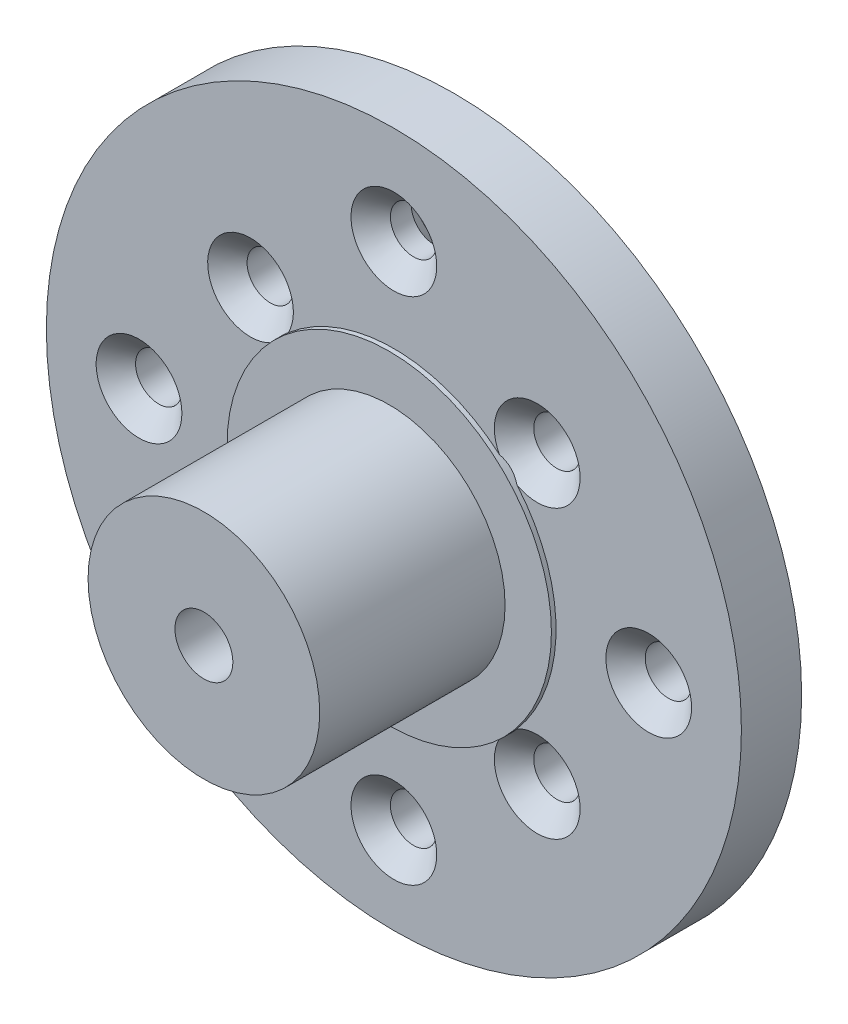
from build123d import *

# Parameters (mm, degrees)
SKETCH_1_R          = 30
SKETCH_1_R_2        = 2
EXTRUDE_1_DEPTH     = 5.2
SKETCH_2_R          = 14
EXTRUDE_2_DEPTH     = 0.4
SKETCH_3_R          = 10
EXTRUDE_3_DEPTH     = 16
SKETCH_4_R          = 2.5
CUT_EXTRUDE_1_DEPTH = 12
CHAMFER_1_SIZE      = 1.7


with BuildPart() as part:
    # 草图1 → 凸台-拉伸1 (new body)
    with BuildSketch(Plane.XY):
        with Locations((0, 0.477974548)):
            Circle(SKETCH_1_R)
        with Locations((0, 22)):
            Circle(SKETCH_1_R_2, mode=Mode.SUBTRACT)
        with Locations((-12.374368671, 12.374368671)):
            Circle(SKETCH_1_R_2, mode=Mode.SUBTRACT)
        with Locations((22, 0)):
            Circle(SKETCH_1_R_2, mode=Mode.SUBTRACT)
        with Locations((12.374368671, 12.374368671)):
            Circle(SKETCH_1_R_2, mode=Mode.SUBTRACT)
        with Locations((0, -22)):
            Circle(SKETCH_1_R_2, mode=Mode.SUBTRACT)
        with Locations((12.374368671, -12.374368671)):
            Circle(SKETCH_1_R_2, mode=Mode.SUBTRACT)
        with Locations((-22, 0)):
            Circle(SKETCH_1_R_2, mode=Mode.SUBTRACT)
        with Locations((-12.374368671, -12.374368671)):
            Circle(SKETCH_1_R_2, mode=Mode.SUBTRACT)
    extrude(amount=EXTRUDE_1_DEPTH)

    # 草图2 → 凸台-拉伸2 (add)
    with BuildSketch(Plane.XY.offset(5.2)):
        Circle(SKETCH_2_R)
    extrude(amount=EXTRUDE_2_DEPTH)

    # 草图3 → 凸台-拉伸3 (add)
    with BuildSketch(Plane.XY.offset(5.6)):
        Circle(SKETCH_3_R)
    extrude(amount=EXTRUDE_3_DEPTH)

    # 草图4 → 切除-拉伸1 (cut)
    with BuildSketch(Plane.XY.offset(21.6)):
        Circle(SKETCH_4_R)
    extrude(amount=-CUT_EXTRUDE_1_DEPTH, mode=Mode.SUBTRACT)

    # 倒角1
    # the kernel refuses this chamfer: 1.7 mm, written as the material it takes off along each edge
    with BuildSketch(Plane(origin=(22, 0, 5.2), x_dir=(1, 0, 0), z_dir=(0, -1, 0))) as chamfer_1_piece_1:
        Polygon((2 + CHAMFER_1_SIZE, 0), (2, -CHAMFER_1_SIZE), (2, 0), align=None)
    revolve(axis=Axis((22, 0, 5.2), (0, 0, 1)), mode=Mode.SUBTRACT)
    with BuildSketch(Plane(origin=(12.374368671, 12.374368671, 5.2), x_dir=(1, 0, 0), z_dir=(0, -1, 0))) as chamfer_1_piece_2_section:
        Polygon((2 + CHAMFER_1_SIZE, 0), (2, -CHAMFER_1_SIZE), (2, 0), align=None)
    chamfer_1_piece_2 = revolve(axis=Axis((12.374368671, 12.374368671, 5.2), (0, 0, 1)), mode=Mode.PRIVATE)
    chamfer_1_piece_2 = chamfer_1_piece_2 - Plane(origin=(0, 0, 4.370822152), x_dir=(1, 0, 0), z_dir=(0, 0, -1)) * Cylinder(14, 15, mode=Mode.PRIVATE)
    add(chamfer_1_piece_2, mode=Mode.SUBTRACT)
    with BuildSketch(Plane(origin=(0, -22, 5.2), x_dir=(1, 0, 0), z_dir=(0, -1, 0))) as chamfer_1_piece_3:
        Polygon((2 + CHAMFER_1_SIZE, 0), (2, -CHAMFER_1_SIZE), (2, 0), align=None)
    revolve(axis=Axis((0, -22, 5.2), (0, 0, 1)), mode=Mode.SUBTRACT)
    with BuildSketch(Plane(origin=(12.374368671, -12.374368671, 5.2), x_dir=(1, 0, 0), z_dir=(0, -1, 0))) as chamfer_1_piece_4_section:
        Polygon((2 + CHAMFER_1_SIZE, 0), (2, -CHAMFER_1_SIZE), (2, 0), align=None)
    chamfer_1_piece_4 = revolve(axis=Axis((12.374368671, -12.374368671, 5.2), (0, 0, 1)), mode=Mode.PRIVATE)
    chamfer_1_piece_4 = chamfer_1_piece_4 - Plane(origin=(0, 0, 4.370822149), x_dir=(1, 0, 0), z_dir=(0, 0, -1)) * Cylinder(14, 15, mode=Mode.PRIVATE)
    add(chamfer_1_piece_4, mode=Mode.SUBTRACT)
    with BuildSketch(Plane(origin=(-22, 0, 5.2), x_dir=(1, 0, 0), z_dir=(0, -1, 0))) as chamfer_1_piece_5:
        Polygon((2 + CHAMFER_1_SIZE, 0), (2, -CHAMFER_1_SIZE), (2, 0), align=None)
    revolve(axis=Axis((-22, 0, 5.2), (0, 0, 1)), mode=Mode.SUBTRACT)
    with BuildSketch(Plane(origin=(-12.374368671, -12.374368671, 5.2), x_dir=(1, 0, 0), z_dir=(0, -1, 0))) as chamfer_1_piece_6_section:
        Polygon((2 + CHAMFER_1_SIZE, 0), (2, -CHAMFER_1_SIZE), (2, 0), align=None)
    chamfer_1_piece_6 = revolve(axis=Axis((-12.374368671, -12.374368671, 5.2), (0, 0, 1)), mode=Mode.PRIVATE)
    chamfer_1_piece_6 = chamfer_1_piece_6 - Plane(origin=(0, 0, 4.370822148), x_dir=(1, 0, 0), z_dir=(0, 0, -1)) * Cylinder(14, 15, mode=Mode.PRIVATE)
    add(chamfer_1_piece_6, mode=Mode.SUBTRACT)
    with BuildSketch(Plane(origin=(0, 22, 0), x_dir=(1, 0, 0), z_dir=(0, -1, 0))) as chamfer_1_piece_7:
        Polygon((2 + CHAMFER_1_SIZE, 0), (2, CHAMFER_1_SIZE), (2, 0), align=None)
    revolve(axis=Axis((0, 22, 0), (0, 0, 1)), mode=Mode.SUBTRACT)
    with BuildSketch(Plane(origin=(0, 22, 5.2), x_dir=(1, 0, 0), z_dir=(0, -1, 0))) as chamfer_1_piece_8:
        Polygon((2 + CHAMFER_1_SIZE, 0), (2, -CHAMFER_1_SIZE), (2, 0), align=None)
    revolve(axis=Axis((0, 22, 5.2), (0, 0, 1)), mode=Mode.SUBTRACT)
    with BuildSketch(Plane(origin=(-12.374368671, 12.374368671, 5.2), x_dir=(1, 0, 0), z_dir=(0, -1, 0))) as chamfer_1_piece_9_section:
        Polygon((2 + CHAMFER_1_SIZE, 0), (2, -CHAMFER_1_SIZE), (2, 0), align=None)
    chamfer_1_piece_9 = revolve(axis=Axis((-12.374368671, 12.374368671, 5.2), (0, 0, 1)), mode=Mode.PRIVATE)
    chamfer_1_piece_9 = chamfer_1_piece_9 - Plane(origin=(0, 0, 4.370822151), x_dir=(1, 0, 0), z_dir=(0, 0, -1)) * Cylinder(14, 15, mode=Mode.PRIVATE)
    add(chamfer_1_piece_9, mode=Mode.SUBTRACT)


solid = part.part
